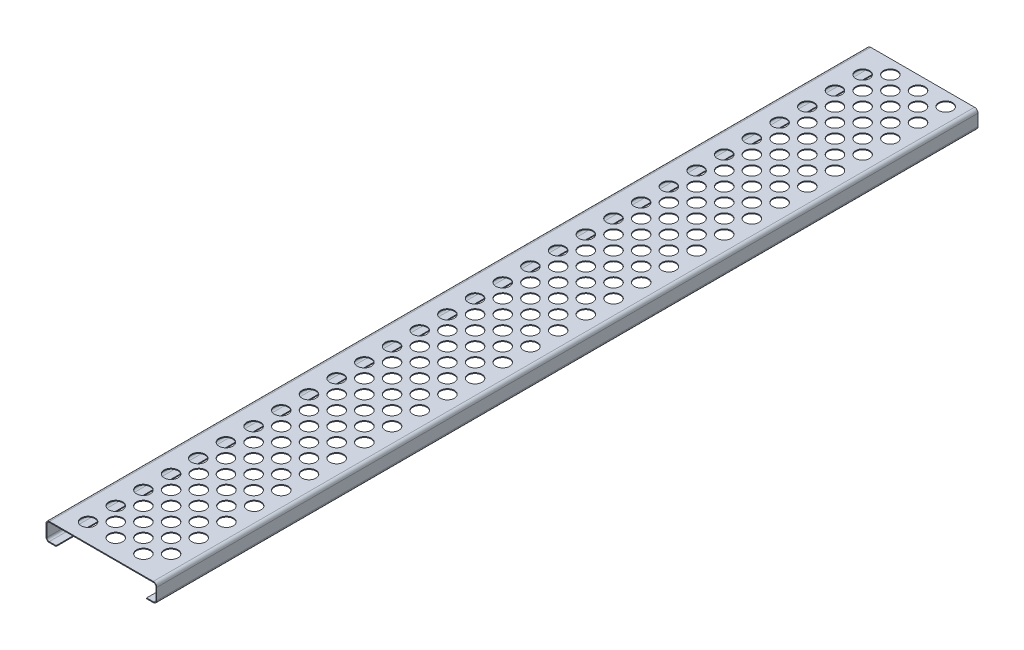
from build123d import *

# Parameters (mm, degrees)
BOSS_EXTRUDE1_DEPTH = 2260.6
SKETCH3_R           = 19.05
CUT_EXTRUDE2_DEPTH  = 2267.300677315


with BuildPart() as part:
    # Sketch1 → Boss-Extrude1 (new body)
    with BuildSketch(Plane.XY):
        with BuildLine():
            Line((-143.66875, 23.01875), (143.66875, 23.01875))
            ThreePointArc((143.66875, 23.01875), (148.158878061, 21.158878061), (150.01875, 16.66875))
            Line((150.01875, 16.66875), (150.01875, -16.66875))
            ThreePointArc((150.01875, -16.66875), (148.158878061, -21.158878061), (143.66875, -23.01875))
            Line((143.66875, -23.01875), (124.61875, -23.01875))
            Line((124.61875, -23.01875), (124.61875, -25.4))
            Line((124.61875, -25.4), (142.875, -25.4))
            ThreePointArc((142.875, -25.4), (149.610192091, -22.610192091), (152.4, -15.875))
            Line((152.4, -15.875), (152.4, 15.875))
            ThreePointArc((152.4, 15.875), (149.610192091, 22.610192091), (142.875, 25.4))
            Line((142.875, 25.4), (-142.875, 25.4))
            ThreePointArc((-142.875, 25.4), (-149.610192091, 22.610192091), (-152.4, 15.875))
            Line((-152.4, 15.875), (-152.4, -15.875))
            ThreePointArc((-152.4, -15.875), (-149.610192091, -22.610192091), (-142.875, -25.4))
            Line((-142.875, -25.4), (-124.61875, -25.4))
            Line((-124.61875, -25.4), (-124.61875, -23.01875))
            Line((-124.61875, -23.01875), (-143.66875, -23.01875))
            ThreePointArc((-143.66875, -23.01875), (-148.158878061, -21.158878061), (-150.01875, -16.66875))
            Line((-150.01875, -16.66875), (-150.01875, 16.66875))
            ThreePointArc((-150.01875, 16.66875), (-148.158878061, 21.158878061), (-143.66875, 23.01875))
        make_face()
    extrude(amount=BOSS_EXTRUDE1_DEPTH)

    # Sketch3 → Cut-Extrude2 (cut, through all)
    with BuildSketch(Plane(origin=(0, 25.4, 0), x_dir=(1, 0, 0), z_dir=(0, 1, 0))):
        with Locations((101.6, -38.1)):
            Circle(SKETCH3_R)
        with Locations((63.5, -76.2)):
            Circle(SKETCH3_R)
        with Locations((-12.7, -76.2)):
            Circle(SKETCH3_R)
        with Locations((25.4, -38.1)):
            Circle(SKETCH3_R)
        with Locations((-88.9, -76.2)):
            Circle(SKETCH3_R)
        with Locations((-50.8, -38.1)):
            Circle(SKETCH3_R)
        with Locations((-12.7, -152.4)):
            Circle(SKETCH3_R)
        with Locations((25.4, -114.3)):
            Circle(SKETCH3_R)
        with Locations((-88.9, -152.4)):
            Circle(SKETCH3_R)
        with Locations((-50.8, -114.3)):
            Circle(SKETCH3_R)
        with Locations((-12.7, -228.6)):
            Circle(SKETCH3_R)
        with Locations((25.4, -190.5)):
            Circle(SKETCH3_R)
        with Locations((-88.9, -228.6)):
            Circle(SKETCH3_R)
        with Locations((-50.8, -190.5)):
            Circle(SKETCH3_R)
        with Locations((-12.7, -304.8)):
            Circle(SKETCH3_R)
        with Locations((25.4, -266.7)):
            Circle(SKETCH3_R)
        with Locations((-88.9, -304.8)):
            Circle(SKETCH3_R)
        with Locations((-50.8, -266.7)):
            Circle(SKETCH3_R)
        with Locations((-12.7, -381)):
            Circle(SKETCH3_R)
        with Locations((25.4, -342.9)):
            Circle(SKETCH3_R)
        with Locations((-88.9, -381)):
            Circle(SKETCH3_R)
        with Locations((-50.8, -342.9)):
            Circle(SKETCH3_R)
        with Locations((-12.7, -457.2)):
            Circle(SKETCH3_R)
        with Locations((25.4, -419.1)):
            Circle(SKETCH3_R)
        with Locations((-88.9, -457.2)):
            Circle(SKETCH3_R)
        with Locations((-50.8, -419.1)):
            Circle(SKETCH3_R)
        with Locations((-12.7, -533.4)):
            Circle(SKETCH3_R)
        with Locations((25.4, -495.3)):
            Circle(SKETCH3_R)
        with Locations((-88.9, -533.4)):
            Circle(SKETCH3_R)
        with Locations((-50.8, -495.3)):
            Circle(SKETCH3_R)
        with Locations((-12.7, -609.6)):
            Circle(SKETCH3_R)
        with Locations((25.4, -571.5)):
            Circle(SKETCH3_R)
        with Locations((-88.9, -609.6)):
            Circle(SKETCH3_R)
        with Locations((-50.8, -571.5)):
            Circle(SKETCH3_R)
        with Locations((-12.7, -685.8)):
            Circle(SKETCH3_R)
        with Locations((25.4, -647.7)):
            Circle(SKETCH3_R)
        with Locations((-88.9, -685.8)):
            Circle(SKETCH3_R)
        with Locations((-50.8, -647.7)):
            Circle(SKETCH3_R)
        with Locations((-12.7, -762)):
            Circle(SKETCH3_R)
        with Locations((25.4, -723.9)):
            Circle(SKETCH3_R)
        with Locations((-88.9, -762)):
            Circle(SKETCH3_R)
        with Locations((-50.8, -723.9)):
            Circle(SKETCH3_R)
        with Locations((-12.7, -838.2)):
            Circle(SKETCH3_R)
        with Locations((25.4, -800.1)):
            Circle(SKETCH3_R)
        with Locations((-88.9, -838.2)):
            Circle(SKETCH3_R)
        with Locations((-50.8, -800.1)):
            Circle(SKETCH3_R)
        with Locations((-12.7, -914.4)):
            Circle(SKETCH3_R)
        with Locations((25.4, -876.3)):
            Circle(SKETCH3_R)
        with Locations((-88.9, -914.4)):
            Circle(SKETCH3_R)
        with Locations((-50.8, -876.3)):
            Circle(SKETCH3_R)
        with Locations((-12.7, -990.6)):
            Circle(SKETCH3_R)
        with Locations((25.4, -952.5)):
            Circle(SKETCH3_R)
        with Locations((-88.9, -990.6)):
            Circle(SKETCH3_R)
        with Locations((-50.8, -952.5)):
            Circle(SKETCH3_R)
        with Locations((-12.7, -1066.8)):
            Circle(SKETCH3_R)
        with Locations((25.4, -1028.7)):
            Circle(SKETCH3_R)
        with Locations((-88.9, -1066.8)):
            Circle(SKETCH3_R)
        with Locations((-50.8, -1028.7)):
            Circle(SKETCH3_R)
        with Locations((-12.7, -1143)):
            Circle(SKETCH3_R)
        with Locations((25.4, -1104.9)):
            Circle(SKETCH3_R)
        with Locations((-88.9, -1143)):
            Circle(SKETCH3_R)
        with Locations((-50.8, -1104.9)):
            Circle(SKETCH3_R)
        with Locations((-12.7, -1219.2)):
            Circle(SKETCH3_R)
        with Locations((25.4, -1181.1)):
            Circle(SKETCH3_R)
        with Locations((-88.9, -1219.2)):
            Circle(SKETCH3_R)
        with Locations((-50.8, -1181.1)):
            Circle(SKETCH3_R)
        with Locations((-12.7, -1295.4)):
            Circle(SKETCH3_R)
        with Locations((25.4, -1257.3)):
            Circle(SKETCH3_R)
        with Locations((-88.9, -1295.4)):
            Circle(SKETCH3_R)
        with Locations((-50.8, -1257.3)):
            Circle(SKETCH3_R)
        with Locations((-12.7, -1371.6)):
            Circle(SKETCH3_R)
        with Locations((25.4, -1333.5)):
            Circle(SKETCH3_R)
        with Locations((-88.9, -1371.6)):
            Circle(SKETCH3_R)
        with Locations((-50.8, -1333.5)):
            Circle(SKETCH3_R)
        with Locations((-12.7, -1447.8)):
            Circle(SKETCH3_R)
        with Locations((25.4, -1409.7)):
            Circle(SKETCH3_R)
        with Locations((-88.9, -1447.8)):
            Circle(SKETCH3_R)
        with Locations((-50.8, -1409.7)):
            Circle(SKETCH3_R)
        with Locations((-12.7, -1524)):
            Circle(SKETCH3_R)
        with Locations((25.4, -1485.9)):
            Circle(SKETCH3_R)
        with Locations((-88.9, -1524)):
            Circle(SKETCH3_R)
        with Locations((-50.8, -1485.9)):
            Circle(SKETCH3_R)
        with Locations((-12.7, -1600.2)):
            Circle(SKETCH3_R)
        with Locations((25.4, -1562.1)):
            Circle(SKETCH3_R)
        with Locations((-88.9, -1600.2)):
            Circle(SKETCH3_R)
        with Locations((-50.8, -1562.1)):
            Circle(SKETCH3_R)
        with Locations((-12.7, -1676.4)):
            Circle(SKETCH3_R)
        with Locations((25.4, -1638.3)):
            Circle(SKETCH3_R)
        with Locations((-88.9, -1676.4)):
            Circle(SKETCH3_R)
        with Locations((-50.8, -1638.3)):
            Circle(SKETCH3_R)
        with Locations((-12.7, -1752.6)):
            Circle(SKETCH3_R)
        with Locations((25.4, -1714.5)):
            Circle(SKETCH3_R)
        with Locations((-88.9, -1752.6)):
            Circle(SKETCH3_R)
        with Locations((-50.8, -1714.5)):
            Circle(SKETCH3_R)
        with Locations((-12.7, -1828.8)):
            Circle(SKETCH3_R)
        with Locations((25.4, -1790.7)):
            Circle(SKETCH3_R)
        with Locations((-88.9, -1828.8)):
            Circle(SKETCH3_R)
        with Locations((-50.8, -1790.7)):
            Circle(SKETCH3_R)
        with Locations((-12.7, -1905)):
            Circle(SKETCH3_R)
        with Locations((25.4, -1866.9)):
            Circle(SKETCH3_R)
        with Locations((-88.9, -1905)):
            Circle(SKETCH3_R)
        with Locations((-50.8, -1866.9)):
            Circle(SKETCH3_R)
        with Locations((63.5, -152.4)):
            Circle(SKETCH3_R)
        with Locations((101.6, -114.3)):
            Circle(SKETCH3_R)
        with Locations((63.5, -228.6)):
            Circle(SKETCH3_R)
        with Locations((101.6, -190.5)):
            Circle(SKETCH3_R)
        with Locations((63.5, -304.8)):
            Circle(SKETCH3_R)
        with Locations((101.6, -266.7)):
            Circle(SKETCH3_R)
        with Locations((63.5, -381)):
            Circle(SKETCH3_R)
        with Locations((101.6, -342.9)):
            Circle(SKETCH3_R)
        with Locations((63.5, -457.2)):
            Circle(SKETCH3_R)
        with Locations((101.6, -419.1)):
            Circle(SKETCH3_R)
        with Locations((63.5, -533.4)):
            Circle(SKETCH3_R)
        with Locations((101.6, -495.3)):
            Circle(SKETCH3_R)
        with Locations((63.5, -609.6)):
            Circle(SKETCH3_R)
        with Locations((101.6, -571.5)):
            Circle(SKETCH3_R)
        with Locations((63.5, -685.8)):
            Circle(SKETCH3_R)
        with Locations((101.6, -647.7)):
            Circle(SKETCH3_R)
        with Locations((63.5, -762)):
            Circle(SKETCH3_R)
        with Locations((101.6, -723.9)):
            Circle(SKETCH3_R)
        with Locations((63.5, -838.2)):
            Circle(SKETCH3_R)
        with Locations((101.6, -800.1)):
            Circle(SKETCH3_R)
        with Locations((63.5, -914.4)):
            Circle(SKETCH3_R)
        with Locations((101.6, -876.3)):
            Circle(SKETCH3_R)
        with Locations((63.5, -990.6)):
            Circle(SKETCH3_R)
        with Locations((101.6, -952.5)):
            Circle(SKETCH3_R)
        with Locations((63.5, -1066.8)):
            Circle(SKETCH3_R)
        with Locations((101.6, -1028.7)):
            Circle(SKETCH3_R)
        with Locations((63.5, -1143)):
            Circle(SKETCH3_R)
        with Locations((101.6, -1104.9)):
            Circle(SKETCH3_R)
        with Locations((63.5, -1219.2)):
            Circle(SKETCH3_R)
        with Locations((101.6, -1181.1)):
            Circle(SKETCH3_R)
        with Locations((63.5, -1295.4)):
            Circle(SKETCH3_R)
        with Locations((101.6, -1257.3)):
            Circle(SKETCH3_R)
        with Locations((63.5, -1371.6)):
            Circle(SKETCH3_R)
        with Locations((101.6, -1333.5)):
            Circle(SKETCH3_R)
        with Locations((63.5, -1447.8)):
            Circle(SKETCH3_R)
        with Locations((101.6, -1409.7)):
            Circle(SKETCH3_R)
        with Locations((63.5, -1524)):
            Circle(SKETCH3_R)
        with Locations((101.6, -1485.9)):
            Circle(SKETCH3_R)
        with Locations((63.5, -1600.2)):
            Circle(SKETCH3_R)
        with Locations((101.6, -1562.1)):
            Circle(SKETCH3_R)
        with Locations((63.5, -1676.4)):
            Circle(SKETCH3_R)
        with Locations((101.6, -1638.3)):
            Circle(SKETCH3_R)
        with Locations((63.5, -1752.6)):
            Circle(SKETCH3_R)
        with Locations((101.6, -1714.5)):
            Circle(SKETCH3_R)
        with Locations((63.5, -1828.8)):
            Circle(SKETCH3_R)
        with Locations((101.6, -1790.7)):
            Circle(SKETCH3_R)
        with Locations((63.5, -1905)):
            Circle(SKETCH3_R)
        with Locations((101.6, -1866.9)):
            Circle(SKETCH3_R)
        with Locations((-12.7, -1979.735057736)):
            Circle(SKETCH3_R)
        with Locations((25.4, -1941.635057736)):
            Circle(SKETCH3_R)
        with Locations((-88.9, -1979.735057736)):
            Circle(SKETCH3_R)
        with Locations((-50.8, -1941.635057736)):
            Circle(SKETCH3_R)
        with Locations((-12.7, -2055.935057736)):
            Circle(SKETCH3_R)
        with Locations((25.4, -2017.835057736)):
            Circle(SKETCH3_R)
        with Locations((-88.9, -2055.935057736)):
            Circle(SKETCH3_R)
        with Locations((-50.8, -2017.835057736)):
            Circle(SKETCH3_R)
        with Locations((-12.7, -2132.135057736)):
            Circle(SKETCH3_R)
        with Locations((25.4, -2094.035057736)):
            Circle(SKETCH3_R)
        with Locations((-88.9, -2132.135057736)):
            Circle(SKETCH3_R)
        with Locations((-50.8, -2094.035057736)):
            Circle(SKETCH3_R)
        with Locations((-12.7, -2208.335057736)):
            Circle(SKETCH3_R)
        with Locations((25.4, -2170.235057736)):
            Circle(SKETCH3_R)
        with Locations((-88.9, -2208.335057736)):
            Circle(SKETCH3_R)
        with Locations((-50.8, -2170.235057736)):
            Circle(SKETCH3_R)
        with Locations((63.5, -1979.735057736)):
            Circle(SKETCH3_R)
        with Locations((101.6, -1941.635057736)):
            Circle(SKETCH3_R)
        with Locations((63.5, -2055.935057736)):
            Circle(SKETCH3_R)
        with Locations((101.6, -2017.835057736)):
            Circle(SKETCH3_R)
        with Locations((63.5, -2132.135057736)):
            Circle(SKETCH3_R)
        with Locations((101.6, -2094.035057736)):
            Circle(SKETCH3_R)
        with Locations((63.5, -2208.335057736)):
            Circle(SKETCH3_R)
        with Locations((101.6, -2170.235057736)):
            Circle(SKETCH3_R)
    extrude(amount=-CUT_EXTRUDE2_DEPTH, mode=Mode.SUBTRACT)


solid = part.part
